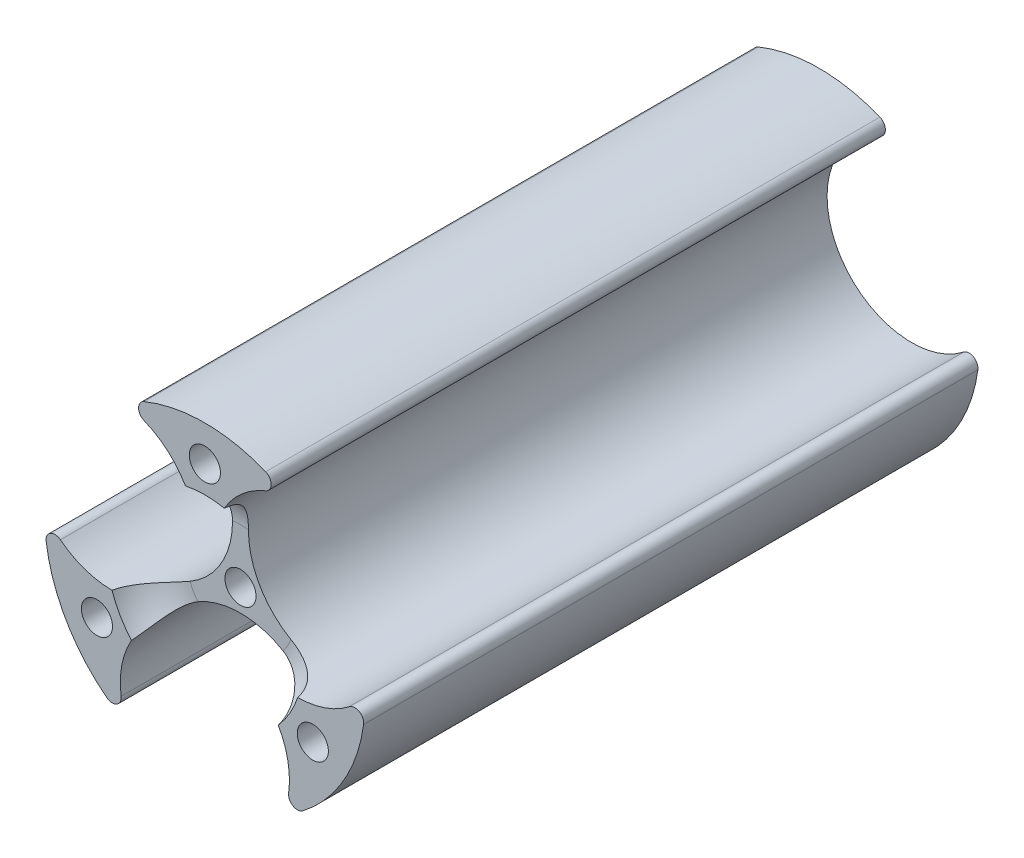
from build123d import *

# Parameters (mm, degrees)
SKETCH_1_R      = 1.75
EXTRUDE_1_DEPTH = 65
FILLET_1_R      = 1
SKETCH_2_R      = 1.75
EXTRUDE_2_DEPTH = 4
FILLET_2_R      = 5


with BuildPart() as part:
    # Эскиз1 → Бобышка-Вытянуть1 (new body)
    with BuildSketch(Plane.XY):
        with BuildLine():
            ThreePointArc((8.733013025, -15.739583333), (15.511193288, -9.132517877), (18, 0))
            ThreePointArc((18, 0), (17.999346369, 0.153395838), (17.997385524, 0.306780536))
            ThreePointArc((17.997385524, 0.306780536), (2.165063509, 1.25), (9.264372499, 15.432802798))
            ThreePointArc((9.264372499, 15.432802798), (0, 18), (-9.264372499, 15.432802798))
            ThreePointArc((-9.264372499, 15.432802798), (-3.287188474, 12.30613363), (-0.892304845, 6))
            ThreePointArc((-0.892304845, 6), (-7.392160386, -3.013830108), (-17.997385524, 0.306780536))
            ThreePointArc((-17.997385524, 0.306780536), (-15.588457268, -9), (-8.733013025, -15.739583333))
            ThreePointArc((-8.733013025, -15.739583333), (-1.908713738, -2.693721911), (9.5, -12))
            ThreePointArc((9.5, -12), (9.306278089, -13.908713738), (8.733013025, -15.739583333))
        make_face()
        with Locations((-12.124355653, -7)):
            Circle(SKETCH_1_R, mode=Mode.SUBTRACT)
        with Locations((12.124355653, -7)):
            Circle(SKETCH_1_R, mode=Mode.SUBTRACT)
        Circle(SKETCH_1_R, mode=Mode.SUBTRACT)
        with Locations((0, 14)):
            Circle(SKETCH_1_R, mode=Mode.SUBTRACT)
    extrude(amount=EXTRUDE_1_DEPTH)

    # Скругление1
    fillet_1_edges = [part.edges().sort_by_distance(p)[0] for p in [
        (17.997385524, 0.306780536, 32.5),
        (8.733013025, -15.739583333, 32.5),
        (-8.733013025, -15.739583333, 32.5),
        (-17.997385524, 0.306780536, 32.5),
        (-9.264372499, 15.432802798, 32.5),
        (9.264372499, 15.432802798, 32.5),
    ]]
    fillet(fillet_1_edges, radius=FILLET_1_R)

    # Эскиз2 → Бобышка-Вытянуть2 (add)
    # profile 1 of 3: a face of its own
    with BuildSketch(Plane.XY.offset(65)):
        with BuildLine():
            ThreePointArc((6.822193962, 14.803653121), (7.446391133, 15.728518462), (6.825592394, 16.655668359))
            ThreePointArc((6.825592394, 16.655668359), (0, 18), (-6.825592394, 16.655668359))
            ThreePointArc((-6.825592394, 16.655668359), (-7.446391133, 15.728518462), (-6.822193962, 14.803653121))
            ThreePointArc((-6.822193962, 14.803653121), (-4.168730882, 13.177543251), (-2.183145185, 10.781181619))
            ThreePointArc((-2.183145185, 10.781181619), (0, 11), (2.183145185, 10.781181619))
            ThreePointArc((2.183145185, 10.781181619), (4.168730882, 13.177543251), (6.822193962, 14.803653121))
        make_face()
        with Locations((0, 14)):
            Circle(SKETCH_2_R, mode=Mode.SUBTRACT)
    # profile 2 of 3: a face of its own
    with BuildSketch(Plane.XY.offset(65)):
        with BuildLine():
            ThreePointArc((17.837028113, -2.41669777), (17.344492118, -1.415495343), (16.231436653, -1.49363328))
            ThreePointArc((16.231436653, -1.49363328), (13.496452656, -2.97854478), (10.428349757, -3.499931619))
            ThreePointArc((10.428349757, -3.499931619), (9.526279442, -5.5), (8.245204572, -7.28125))
            ThreePointArc((8.245204572, -7.28125), (9.1809434, -9.558631883), (9.5, -12))
            ThreePointArc((9.5, -12), (9.477283513, -12.656579941), (9.409242691, -13.310019841))
            ThreePointArc((9.409242691, -13.310019841), (9.898100985, -14.313023118), (11.011435719, -14.238970588))
            ThreePointArc((11.011435719, -14.238970588), (15.588457268, -9), (17.837028113, -2.41669777))
        make_face()
        with Locations((12.124355653, -7)):
            Circle(SKETCH_2_R, mode=Mode.SUBTRACT)
    # profile 3 of 3: a face of its own
    with BuildSketch(Plane.XY.offset(65)):
        with BuildLine():
            ThreePointArc((-10.428349757, -3.499931619), (-13.496452656, -2.97854478), (-16.231436653, -1.49363328))
            ThreePointArc((-16.231436653, -1.49363328), (-17.344492118, -1.415495343), (-17.837028113, -2.41669777))
            ThreePointArc((-17.837028113, -2.41669777), (-15.588457268, -9), (-11.011435719, -14.238970588))
            ThreePointArc((-11.011435719, -14.238970588), (-9.898100985, -14.313023118), (-9.409242691, -13.310019841))
            ThreePointArc((-9.409242691, -13.310019841), (-9.327721774, -10.198998471), (-8.245204572, -7.28125))
            ThreePointArc((-8.245204572, -7.28125), (-9.526279442, -5.5), (-10.428349757, -3.499931619))
        make_face()
        with Locations((-12.124355653, -7)):
            Circle(SKETCH_2_R, mode=Mode.SUBTRACT)
    extrude(amount=EXTRUDE_2_DEPTH)

    # Скругление2
    # the kernel refuses this fillet: 5 mm, written as the material it adds along each edge
    with BuildSketch(Plane(origin=(0, 0, 65), x_dir=(0.26290330045081145, -0.9648221880803066, 0), z_dir=(0.9648221880803066, 0.26290330045081145, 0))) as fillet_2_piece_1_section:
        with BuildLine():
            CenterArc((6.101020514, -5), FILLET_2_R, 11.536959033, 78.463040967)
            Line((6.101020514, 0), (6.101020514, 0.1))
            Line((6.101020514, 0.1), (11, 0.1))
            Line((11, 0.1), (11.1, 0))
            ThreePointArc((11.1, 0), (11.1, -2), (11.09797959, -3.98))
            Line((11.09797959, -3.98), (11, -4))
        make_face()
    fillet_2_piece_1 = revolve(axis=Axis((0, 0, 65), (0, 0, -1)), revolution_arc=150.484807428, mode=Mode.PRIVATE)
    fillet_2_piece_1 = fillet_2_piece_1 - Plane(origin=(-10.392304845, 6, 66.122013519), x_dir=(0.1187297206541081, 0.9929266102957446, 0), z_dir=(0, 0, -1)) * Cylinder(9.5, 45, mode=Mode.PRIVATE)
    fillet_2_piece_1 = fillet_2_piece_1 - Plane(origin=(0, -12, 66.122013519), x_dir=(-0.9192645289367253, -0.3936403508772196, 0), z_dir=(0, 0, -1)) * Cylinder(9.5, 45, mode=Mode.PRIVATE)
    add(fillet_2_piece_1)
    with BuildSketch(Plane(origin=(0, 0, 65), x_dir=(0.7041088747870229, 0.7100920309693333, 0), z_dir=(-0.7100920309693333, 0.7041088747870229, 0))) as fillet_2_piece_2_section:
        with BuildLine():
            CenterArc((6.101020514, -5), FILLET_2_R, 11.536959033, 78.463040967)
            Line((11, -4), (11.09797959, -3.98))
            ThreePointArc((11.09797959, -3.98), (11.1, -2), (11.1, 0))
            Line((11.1, 0), (11, 0.1))
            Line((11, 0.1), (6.101020514, 0.1))
            Line((6.101020514, 0.1), (6.101020514, 0))
        make_face()
    fillet_2_piece_2 = revolve(axis=Axis((0, 0, 65), (0, 0, -1)), revolution_arc=150.484807428, mode=Mode.PRIVATE)
    fillet_2_piece_2 = fillet_2_piece_2 - Plane(origin=(10.392304845, 6, 66.122013516), x_dir=(0.8005348082826462, -0.5992862594185411, 0), z_dir=(0, 0, -1)) * Cylinder(9.5, 45, mode=Mode.PRIVATE)
    fillet_2_piece_2 = fillet_2_piece_2 - Plane(origin=(0, -12, 66.122013516), x_dir=(-0.9192645289367253, -0.3936403508772196, 0), z_dir=(0, 0, -1)) * Cylinder(9.5, 45, mode=Mode.PRIVATE)
    add(fillet_2_piece_2)
    with BuildSketch(Plane(origin=(0, 0, 65), x_dir=(-0.9670121752378409, 0.2547301571109701, 0), z_dir=(-0.2547301571109701, -0.9670121752378409, 0))) as fillet_2_piece_3_section:
        with BuildLine():
            CenterArc((6.101020514, -5), FILLET_2_R, 11.536959033, 78.463040967)
            Line((6.101020514, 0), (6.101020514, 0.1))
            Line((6.101020514, 0.1), (11, 0.1))
            Line((11, 0.1), (11.1, 0))
            ThreePointArc((11.1, 0), (11.1, -2), (11.09797959, -3.98))
            Line((11.09797959, -3.98), (11, -4))
        make_face()
    fillet_2_piece_3 = revolve(axis=Axis((0, 0, 65), (0, 0, -1)), revolution_arc=150.484807428, mode=Mode.PRIVATE)
    fillet_2_piece_3 = fillet_2_piece_3 - Plane(origin=(10.392304845, 6, 66.122013519), x_dir=(0.8005348082826462, -0.5992862594185411, 0), z_dir=(0, 0, -1)) * Cylinder(9.5, 45, mode=Mode.PRIVATE)
    fillet_2_piece_3 = fillet_2_piece_3 - Plane(origin=(-10.392304845, 6, 66.122013519), x_dir=(0.1187297206541081, 0.9929266102957446, 0), z_dir=(0, 0, -1)) * Cylinder(9.5, 45, mode=Mode.PRIVATE)
    add(fillet_2_piece_3)


solid = part.part
